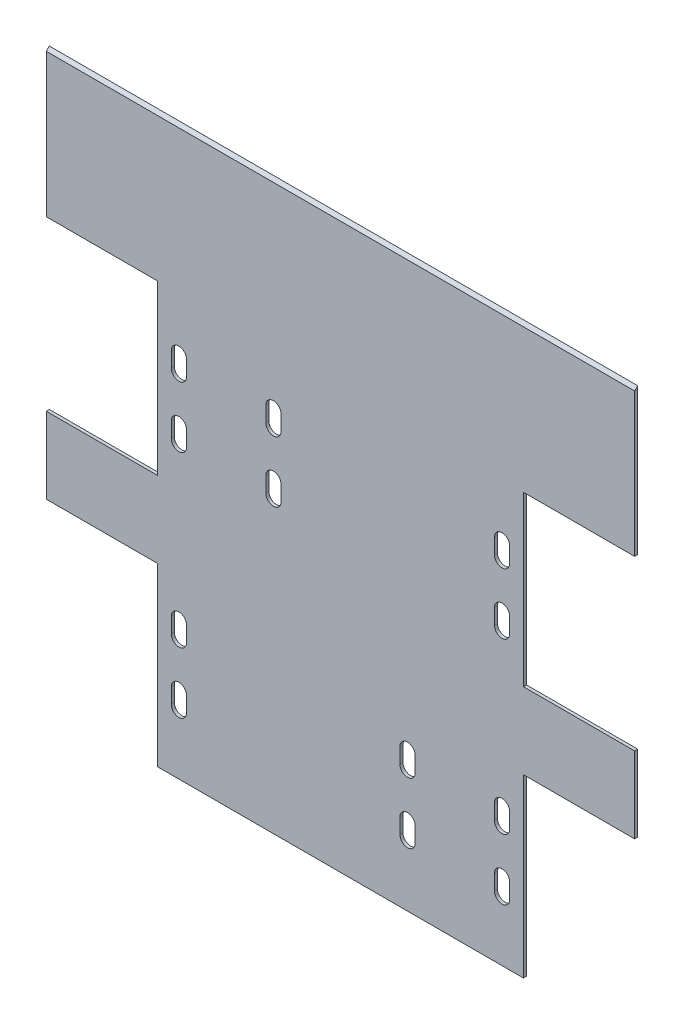
from build123d import *

# Parameters (mm, degrees)
SKETCH1_W           = 193
SKETCH1_H           = 145
SKETCH1_W_2         = 35
SKETCH1_H_2         = 60
BOSS_EXTRUDE1_DEPTH = 1
SKETCH2_R           = 2.5
CUT_EXTRUDE1_DEPTH  = 3
SKETCH3_W           = 1.5
SKETCH3_H           = 60.155824732
SKETCH3_H_2         = 60
CUT_EXTRUDE2_DEPTH  = 3
SKETCH4_W           = 193
SKETCH4_H           = 42
BOSS_EXTRUDE2_DEPTH = 1
SKETCH5_W           = 1
SKETCH5_H           = 25
BOSS_EXTRUDE3_DEPTH = 194
CHAMFER1_SIZE       = 2
SKETCH7_W           = 36.5
SKETCH7_H           = 3
CUT_EXTRUDE3_DEPTH  = 10
SKETCH8_R           = 2.5
CUT_EXTRUDE4_DEPTH  = 10
SKETCH11_W          = 1
SKETCH11_H          = 25
CUT_EXTRUDE5_DEPTH  = 1
CUT_EXTRUDE6_DEPTH  = 10


with BuildPart() as part:
    # Sketch1 → Boss-Extrude1 (new body)
    with BuildSketch(Plane.XY):
        Rectangle(SKETCH1_W, SKETCH1_H)
        with Locations((-77.5, 35.5)):
            Rectangle(SKETCH1_W_2, SKETCH1_H_2, mode=Mode.SUBTRACT)
        with Locations((77.5, 35.5)):
            Rectangle(SKETCH1_W_2, SKETCH1_H_2, mode=Mode.SUBTRACT)
        with Locations((77.5, -39.5)):
            Rectangle(SKETCH1_W_2, SKETCH1_H_2, mode=Mode.SUBTRACT)
        with Locations((-77.5, -39.5)):
            Rectangle(SKETCH1_W_2, SKETCH1_H_2, mode=Mode.SUBTRACT)
    extrude(amount=BOSS_EXTRUDE1_DEPTH)

    # Sketch2 → Cut-Extrude1 (cut)
    with BuildSketch(Plane.XY.offset(1)):
        with Locations((-53, 45.5)):
            Circle(SKETCH2_R)
        with Locations((-53, 25.5)):
            Circle(SKETCH2_R)
        with Locations((-53, -49.5)):
            Circle(SKETCH2_R)
        with Locations((-53, -29.5)):
            Circle(SKETCH2_R)
        with Locations((53, -29.5)):
            Circle(SKETCH2_R)
        with Locations((53, -49.5)):
            Circle(SKETCH2_R)
        with Locations((53, 25.5)):
            Circle(SKETCH2_R)
        with Locations((53, 45.5)):
            Circle(SKETCH2_R)
    extrude(amount=-CUT_EXTRUDE1_DEPTH, mode=Mode.SUBTRACT)

    # Sketch3 → Cut-Extrude2 (cut)
    with BuildSketch(Plane.XY.offset(1)):
        with Locations((-95.75, 35.422087634)):
            Rectangle(SKETCH3_W, SKETCH3_H)
        with Locations((-95.75, -39.5)):
            Rectangle(SKETCH3_W, SKETCH3_H_2)
        with Locations((95.75, -39.5)):
            Rectangle(SKETCH3_W, SKETCH3_H_2)
        with Locations((95.75, 35.5)):
            Rectangle(SKETCH3_W, SKETCH3_H_2)
    extrude(amount=-CUT_EXTRUDE2_DEPTH, mode=Mode.SUBTRACT)

    # Sketch4 → Boss-Extrude2 (add)
    with BuildSketch(Plane.XY.offset(1)):
        with Locations((0, 93.5)):
            Rectangle(SKETCH4_W, SKETCH4_H)
    extrude(amount=-BOSS_EXTRUDE2_DEPTH)

    # Sketch5 → Boss-Extrude3 (add)
    with BuildSketch(Plane.ZY.offset(96.5)):
        with Locations((0.5, -2.240916736)):
            Rectangle(SKETCH5_W, SKETCH5_H)
    extrude(amount=-BOSS_EXTRUDE3_DEPTH)

    # Chamfer1
    # the kernel refuses this chamfer: 2 mm, written as the material it takes off along each edge
    with BuildSketch(Plane(origin=(101.643365976, 114.5, 1), x_dir=(0, -0.9996219169112968, 0.027495876610586306), z_dir=(-1, 0, 0))) as chamfer1_piece_1:
        Polygon((CHAMFER1_SIZE * 0.999621916911, -CHAMFER1_SIZE * 0.0274958766106), (-CHAMFER1_SIZE * 0.0274958766106, -CHAMFER1_SIZE * 0.999621916911), (0, 0), align=None)
    extrude(amount=203.286731952, mode=Mode.SUBTRACT)

    # Sketch7 → Cut-Extrude3 (cut)
    with BuildSketch(Plane.XY.offset(1)):
        with Locations((-78.25, -71)):
            Rectangle(SKETCH7_W, SKETCH7_H)
        with Locations((78.25, -71)):
            Rectangle(SKETCH7_W, SKETCH7_H)
    extrude(amount=-CUT_EXTRUDE3_DEPTH, mode=Mode.SUBTRACT)

    # Sketch8 → Cut-Extrude4 (cut)
    with BuildSketch(Plane.XY.offset(1)):
        with Locations((-22, 45.5)):
            Circle(SKETCH8_R)
        with Locations((-22, 25.5)):
            Circle(SKETCH8_R)
        with Locations((22, -29.5)):
            Circle(SKETCH8_R)
        with Locations((22, -49.5)):
            Circle(SKETCH8_R)
    extrude(amount=-CUT_EXTRUDE4_DEPTH, mode=Mode.SUBTRACT)

    # Sketch11 → Cut-Extrude5 (cut)
    with BuildSketch(Plane(origin=(97.5, 0, 0), x_dir=(0, 0, -1), z_dir=(1, 0, 0))):
        with Locations((-0.5, -2.240916736)):
            Rectangle(SKETCH11_W, SKETCH11_H)
    extrude(amount=-CUT_EXTRUDE5_DEPTH, mode=Mode.SUBTRACT)

    # Sketch12 → Cut-Extrude6 (cut)
    with BuildSketch(Plane.XY.offset(1)):
        with BuildLine():
            Line((-50.5, 48), (-50.5, 43))
            ThreePointArc((-50.5, 43), (-53, 40.5), (-55.5, 43))
            Line((-55.5, 43), (-55.5, 48))
            ThreePointArc((-55.5, 48), (-53, 50.5), (-50.5, 48))
        make_face()
        with BuildLine():
            Line((-19.5, 48), (-19.5, 43))
            ThreePointArc((-19.5, 43), (-22, 40.5), (-24.5, 43))
            Line((-24.5, 43), (-24.5, 48))
            ThreePointArc((-24.5, 48), (-22, 50.5), (-19.5, 48))
        make_face()
        with BuildLine():
            Line((-19.5, 28), (-19.5, 23))
            ThreePointArc((-19.5, 23), (-22, 20.5), (-24.5, 23))
            Line((-24.5, 23), (-24.5, 28))
            ThreePointArc((-24.5, 28), (-22, 30.5), (-19.5, 28))
        make_face()
        with BuildLine():
            Line((-50.5, 28), (-50.5, 23))
            ThreePointArc((-50.5, 23), (-53, 20.5), (-55.5, 23))
            Line((-55.5, 23), (-55.5, 28))
            ThreePointArc((-55.5, 28), (-53, 30.5), (-50.5, 28))
        make_face()
        with BuildLine():
            Line((50.5, 28), (50.5, 23))
            ThreePointArc((50.5, 23), (53, 20.5), (55.5, 23))
            Line((55.5, 23), (55.5, 28))
            ThreePointArc((55.5, 28), (53, 30.5), (50.5, 28))
        make_face()
        with BuildLine():
            Line((50.5, 48), (50.5, 43))
            ThreePointArc((50.5, 43), (53, 40.5), (55.5, 43))
            Line((55.5, 43), (55.5, 48))
            ThreePointArc((55.5, 48), (53, 50.5), (50.5, 48))
        make_face()
        with BuildLine():
            Line((50.5, -52.481833472), (50.5, -47.481833472))
            ThreePointArc((50.5, -47.481833472), (53, -44.981833472), (55.5, -47.481833472))
            Line((55.5, -47.481833472), (55.5, -52.481833472))
            ThreePointArc((55.5, -52.481833472), (53, -54.981833472), (50.5, -52.481833472))
        make_face()
        with BuildLine():
            Line((50.5, -32.481833472), (50.5, -27.481833472))
            ThreePointArc((50.5, -27.481833472), (53, -24.981833472), (55.5, -27.481833472))
            Line((55.5, -27.481833472), (55.5, -32.481833472))
            ThreePointArc((55.5, -32.481833472), (53, -34.981833472), (50.5, -32.481833472))
        make_face()
        with BuildLine():
            Line((-50.5, -32.481833472), (-50.5, -27.481833472))
            ThreePointArc((-50.5, -27.481833472), (-53, -24.981833472), (-55.5, -27.481833472))
            Line((-55.5, -27.481833472), (-55.5, -32.481833472))
            ThreePointArc((-55.5, -32.481833472), (-53, -34.981833472), (-50.5, -32.481833472))
        make_face()
        with BuildLine():
            Line((-50.5, -52.481833472), (-50.5, -47.481833472))
            ThreePointArc((-50.5, -47.481833472), (-53, -44.981833472), (-55.5, -47.481833472))
            Line((-55.5, -47.481833472), (-55.5, -52.481833472))
            ThreePointArc((-55.5, -52.481833472), (-53, -54.981833472), (-50.5, -52.481833472))
        make_face()
        with BuildLine():
            Line((24.5, -27), (24.5, -32))
            ThreePointArc((24.5, -32), (22, -34.5), (19.5, -32))
            Line((19.5, -32), (19.5, -27))
            ThreePointArc((19.5, -27), (22, -24.5), (24.5, -27))
        make_face()
        with BuildLine():
            Line((24.5, -47), (24.5, -52))
            ThreePointArc((24.5, -52), (22, -54.5), (19.5, -52))
            Line((19.5, -52), (19.5, -47))
            ThreePointArc((19.5, -47), (22, -44.5), (24.5, -47))
        make_face()
    extrude(amount=-CUT_EXTRUDE6_DEPTH, mode=Mode.SUBTRACT)


solid = part.part
